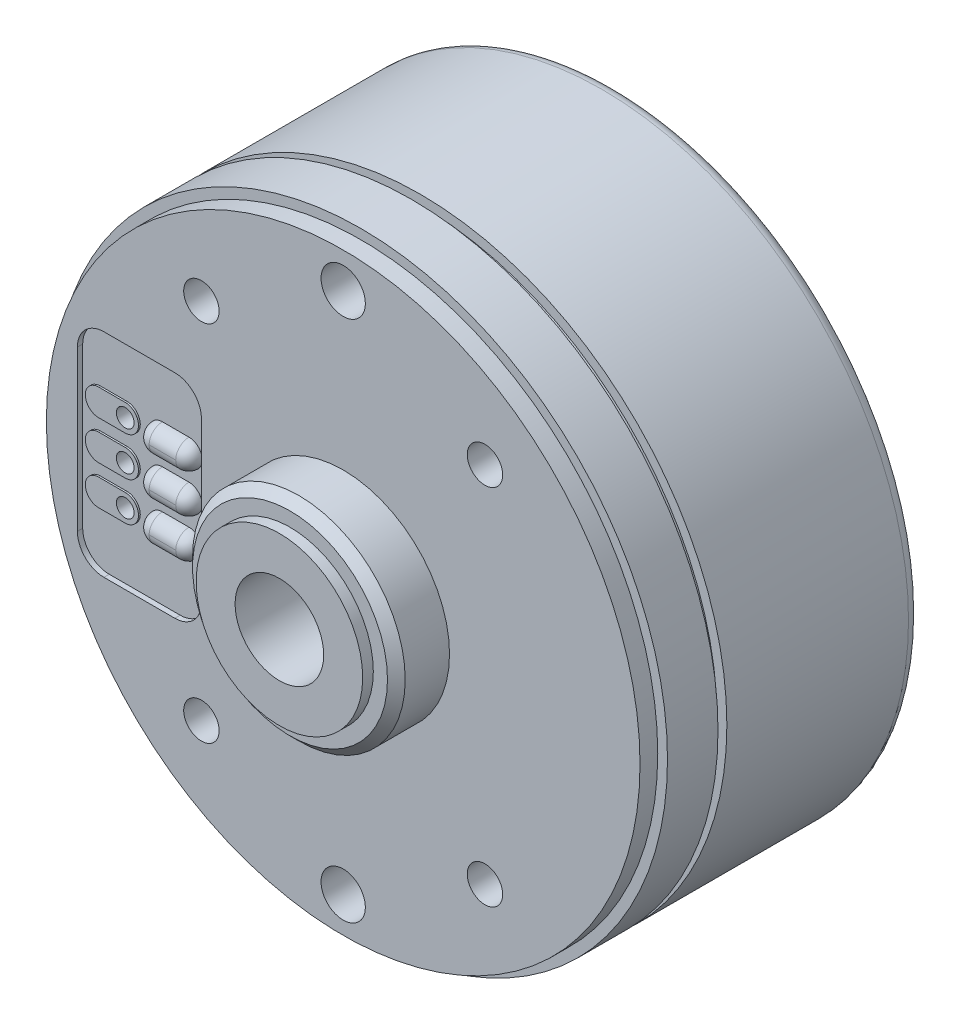
from build123d import *

# Parameters (mm, degrees)
SKETCH_1_R           = 6
EXTRUDE_1_DEPTH      = 3
SKETCH_1_3_R         = 4.7
EXTRUDE_2_DEPTH      = 3.6
SKETCH_1_4_R         = 2.5
CUT_EXTRUDE_1_DEPTH  = 3.6
SKETCH_1_7_R         = 17.3
EXTRUDE_4_DEPTH      = 15.3
SKETCH_1_8_R         = 17.3
SKETCH_1_8_R_2       = 16.75
CUT_EXTRUDE_3_DEPTH  = 4.35
SKETCH_1_5_R         = 17.3
EXTRUDE_3_DEPTH      = 3.85
SKETCH_1_6_R         = 17.3
SKETCH_1_6_R_2       = 16.75
CUT_EXTRUDE_2_DEPTH  = 1
SKETCH_5_R           = 3.25
CUT_EXTRUDE_4_DEPTH  = 10.6
SKETCH_5_3_R         = 1.25
SKETCH_5_3_R_2       = 1
CUT_EXTRUDE_5_DEPTH  = 2.5
SKETCH_1_9_R         = 1.25
SKETCH_1_9_R_2       = 1
CUT_EXTRUDE_6_DEPTH  = 3.8
FILLET_1_R           = 0.7
CHAMFER_1_SIZE       = 0.5
CUT_EXTRUDE_START    = -10
SKETCH_1_10_R        = 2.5
CUT_EXTRUDE_7_DEPTH  = 10
CUT_EXTRUDE_8_DEPTH  = 0.3
EXTRUDE_5_DEPTH      = 0.45
EXTRUDE_5_2_DEPTH    = 0.45
EXTRUDE_5_3_DEPTH    = 0.45
EXTRUDE_6_DEPTH      = 0.3
FILLET_2_R           = 0.75
FILLET_3_R           = 0.75
FILLET_4_R           = 0.75
EXTRUDE_7_DEPTH      = 0.3
SKETCH_1_13_R        = 0.5
CUT_EXTRUDE_9_DEPTH  = 2
CUT_EXTRUDE_10_DEPTH = 0.2


with BuildPart() as part:
    # 草图1 → 凸台-拉伸1 (new body)
    with BuildSketch(Plane.XY):
        Circle(SKETCH_1_R)
    extrude(amount=EXTRUDE_1_DEPTH)

    # 草图1<3> → 凸台-拉伸2 (add)
    with BuildSketch(Plane.XY):
        Circle(SKETCH_1_3_R)
    extrude(amount=EXTRUDE_2_DEPTH)

    # 草图1<4> → 切除-拉伸1 (cut)
    with BuildSketch(Plane.XY):
        Circle(SKETCH_1_4_R)
    extrude(amount=CUT_EXTRUDE_1_DEPTH, mode=Mode.SUBTRACT)

    # 草图1<7> → 凸台-拉伸4 (add)
    with BuildSketch(Plane.XY):
        Circle(SKETCH_1_7_R)
    extrude(amount=-EXTRUDE_4_DEPTH)

    # 草图1<8> → 切除-拉伸3 (cut)
    with BuildSketch(Plane.XY):
        Circle(SKETCH_1_8_R)
        Circle(SKETCH_1_8_R_2, mode=Mode.SUBTRACT)
    extrude(amount=-CUT_EXTRUDE_3_DEPTH, mode=Mode.SUBTRACT)

    # 草图1<5> → 凸台-拉伸3 (add)
    with BuildSketch(Plane.XY):
        Circle(SKETCH_1_5_R)
    extrude(amount=-EXTRUDE_3_DEPTH)

    # 草图1<6> → 切除-拉伸2 (cut)
    with BuildSketch(Plane.XY):
        Circle(SKETCH_1_6_R)
        Circle(SKETCH_1_6_R_2, mode=Mode.SUBTRACT)
    extrude(amount=-CUT_EXTRUDE_2_DEPTH, mode=Mode.SUBTRACT)

    # 草图5 → 切除-拉伸4 (cut)
    with BuildSketch(Plane(origin=(0, 0, -15.3), x_dir=(-1, 0, 0), z_dir=(0, 0, -1))):
        Circle(SKETCH_5_R)
    extrude(amount=-CUT_EXTRUDE_4_DEPTH, mode=Mode.SUBTRACT)

    # 草图5<3> → 切除-拉伸5 (cut)
    with BuildSketch(Plane(origin=(0, 0, -15.3), x_dir=(-1, 0, 0), z_dir=(0, 0, -1))):
        with Locations((-5.25, 5.25)):
            Circle(SKETCH_5_3_R)
        with Locations((0, 6.25)):
            Circle(SKETCH_5_3_R_2)
        with Locations((5.25, 5.25)):
            Circle(SKETCH_5_3_R)
        with Locations((6.25, 0)):
            Circle(SKETCH_5_3_R_2)
        with Locations((5.25, -5.25)):
            Circle(SKETCH_5_3_R)
        with Locations((0, -6.25)):
            Circle(SKETCH_5_3_R_2)
        with Locations((-5.25, -5.25)):
            Circle(SKETCH_5_3_R)
        with Locations((-6.25, 0)):
            Circle(SKETCH_5_3_R_2)
    extrude(amount=-CUT_EXTRUDE_5_DEPTH, mode=Mode.SUBTRACT)

    # 草图1<9> → 切除-拉伸6 (cut)
    with BuildSketch(Plane.XY):
        with Locations((0, 14.75)):
            Circle(SKETCH_1_9_R)
        with Locations((8, 10.25)):
            Circle(SKETCH_1_9_R_2)
        with Locations((8, -10.25)):
            Circle(SKETCH_1_9_R_2)
        with Locations((0, -14.75)):
            Circle(SKETCH_1_9_R)
        with Locations((-8, -10.25)):
            Circle(SKETCH_1_9_R_2)
        with Locations((-8, 10.25)):
            Circle(SKETCH_1_9_R_2)
    extrude(amount=-CUT_EXTRUDE_6_DEPTH, mode=Mode.SUBTRACT)

    # 圆角1
    fillet_1_edges = [part.edges().sort_by_distance(p)[0] for p in [
        (-17.3, 0, -15.3),
    ]]
    fillet(fillet_1_edges, radius=FILLET_1_R)

    # 倒角1
    chamfer_1_edges = [part.edges().sort_by_distance(p)[0] for p in [
        (-6, 0, 3),
    ]]
    chamfer(chamfer_1_edges, length=CHAMFER_1_SIZE)

    # 草图1<10> → 切除-拉伸7 (cut)
    with BuildSketch(Plane.XY.offset(CUT_EXTRUDE_START)):
        with Locations(Location((0, 0, 0), (0, 0, 180))):
            Circle(SKETCH_1_10_R)
    extrude(amount=CUT_EXTRUDE_7_DEPTH, mode=Mode.SUBTRACT)

    # 草图1<11> → 切除-拉伸8 (cut)
    with BuildSketch(Plane.XY):
        with BuildLine():
            Line((-9.5, 6), (-13.5, 6))
            ThreePointArc((-13.5, 6), (-14.560660172, 5.560660172), (-15, 4.5))
            Line((-15, 4.5), (-15, -4.5))
            ThreePointArc((-15, -4.5), (-14.560660172, -5.560660172), (-13.5, -6))
            Line((-13.5, -6), (-9.5, -6))
            ThreePointArc((-9.5, -6), (-8.439339828, -5.560660172), (-8, -4.5))
            Line((-8, -4.5), (-8, 4.5))
            ThreePointArc((-8, 4.5), (-8.439339828, 5.560660172), (-9.5, 6))
        make_face()
    extrude(amount=-CUT_EXTRUDE_8_DEPTH, mode=Mode.SUBTRACT)



with BuildPart() as body_2:
    # 草图1<12> → 凸台-拉伸5 (new body)
    with BuildSketch(Plane.XY):
        with BuildLine():
            ThreePointArc((-9, 0.75), (-8.25, 0), (-9, -0.75))
            Line((-9, -0.75), (-10.5, -0.75))
            ThreePointArc((-10.5, -0.75), (-11.25, 0), (-10.5, 0.75))
            Line((-10.5, 0.75), (-9, 0.75))
        make_face()
    extrude(amount=EXTRUDE_5_DEPTH)


with BuildPart() as body_3:
    # 草图1<12> → Extrude 5 2 (new body)
    with BuildSketch(Plane.XY):
        with BuildLine():
            ThreePointArc((-9, -1.45), (-8.25, -2.2), (-9, -2.95))
            Line((-9, -2.95), (-10.5, -2.95))
            ThreePointArc((-10.5, -2.95), (-11.25, -2.2), (-10.5, -1.45))
            Line((-10.5, -1.45), (-9, -1.45))
        make_face()
    extrude(amount=EXTRUDE_5_2_DEPTH)


with BuildPart() as body_4:
    # 草图1<12> → Extrude 5 3 (new body)
    with BuildSketch(Plane.XY):
        with BuildLine():
            ThreePointArc((-9, 2.95), (-8.25, 2.2), (-9, 1.45))
            Line((-9, 1.45), (-10.5, 1.45))
            ThreePointArc((-10.5, 1.45), (-11.25, 2.2), (-10.5, 2.95))
            Line((-10.5, 2.95), (-9, 2.95))
        make_face()
    extrude(amount=EXTRUDE_5_3_DEPTH)


with BuildPart() as part_1:
    add(part.part)

    add(body_2.part)  # 凸台-拉伸6 merges body 2

    add(body_3.part)  # 凸台-拉伸6 merges body 3

    add(body_4.part)  # 凸台-拉伸6 merges body 4
    # 草图1<14> → 凸台-拉伸6 (add)
    with BuildSketch(Plane.XY):
        with BuildLine():
            Line((-10.5, -0.75), (-9, -0.75))
            ThreePointArc((-9, -0.75), (-8.25, 0), (-9, 0.75))
            Line((-9, 0.75), (-10.5, 0.75))
            ThreePointArc((-10.5, 0.75), (-11.25, 0), (-10.5, -0.75))
        make_face()
        with BuildLine():
            Line((-10.5, -2.95), (-9, -2.95))
            ThreePointArc((-9, -2.95), (-8.25, -2.2), (-9, -1.45))
            Line((-9, -1.45), (-10.5, -1.45))
            ThreePointArc((-10.5, -1.45), (-11.25, -2.2), (-10.5, -2.95))
        make_face()
        with BuildLine():
            Line((-10.5, 1.45), (-9, 1.45))
            ThreePointArc((-9, 1.45), (-8.25, 2.2), (-9, 2.95))
            Line((-9, 2.95), (-10.5, 2.95))
            ThreePointArc((-10.5, 2.95), (-11.25, 2.2), (-10.5, 1.45))
        make_face()
    extrude(amount=-EXTRUDE_6_DEPTH)

    # 圆角2
    fillet_2_edges = [part_1.edges().sort_by_distance(p)[0] for p in [
        (-11.25, 2.2, 0.45),
        (-9.75, 1.45, 0.45),
        (-8.25, 2.2, 0.45),
        (-9.75, 2.95, 0.45),
    ]]
    fillet(fillet_2_edges, radius=FILLET_2_R - 0.0001)  # a hair under: the kernel refuses the full size

    # 圆角3
    fillet_3_edges = [part_1.edges().sort_by_distance(p)[0] for p in [
        (-11.25, 0, 0.45),
        (-9.75, -0.75, 0.45),
        (-8.25, 0, 0.45),
        (-9.75, 0.75, 0.45),
    ]]
    fillet(fillet_3_edges, radius=FILLET_3_R - 0.0001)  # a hair under: the kernel refuses the full size

    # 圆角4
    fillet_4_edges = [part_1.edges().sort_by_distance(p)[0] for p in [
        (-11.25, -2.2, 0.45),
        (-9.75, -2.95, 0.45),
        (-8.25, -2.2, 0.45),
        (-9.75, -1.45, 0.45),
    ]]
    fillet(fillet_4_edges, radius=FILLET_4_R - 0.0001)  # a hair under: the kernel refuses the full size

    # 草图1<15> → 凸台-拉伸7 (add)
    with BuildSketch(Plane.XY):
        with BuildLine():
            Line((-12.5, -0.75), (-14, -0.75))
            ThreePointArc((-14, -0.75), (-14.75, 0), (-14, 0.75))
            Line((-14, 0.75), (-12.5, 0.75))
            ThreePointArc((-12.5, 0.75), (-11.75, 0), (-12.5, -0.75))
        make_face()
        with BuildLine():
            Line((-12.5, 1.45), (-14, 1.45))
            ThreePointArc((-14, 1.45), (-14.75, 2.2), (-14, 2.95))
            Line((-14, 2.95), (-12.5, 2.95))
            ThreePointArc((-12.5, 2.95), (-11.75, 2.2), (-12.5, 1.45))
        make_face()
        with BuildLine():
            Line((-12.5, -2.95), (-14, -2.95))
            ThreePointArc((-14, -2.95), (-14.75, -2.2), (-14, -1.45))
            Line((-14, -1.45), (-12.5, -1.45))
            ThreePointArc((-12.5, -1.45), (-11.75, -2.2), (-12.5, -2.95))
        make_face()
    extrude(amount=-EXTRUDE_7_DEPTH)

    # 草图1<13> → 切除-拉伸9 (cut)
    with BuildSketch(Plane.XY):
        with Locations((-12.5, 0)):
            Circle(SKETCH_1_13_R)
        with Locations((-12.5, 2.2)):
            Circle(SKETCH_1_13_R)
        with Locations((-12.5, -2.2)):
            Circle(SKETCH_1_13_R)
    extrude(amount=-CUT_EXTRUDE_9_DEPTH, mode=Mode.SUBTRACT)

    # 草图1<16> → 切除-拉伸10 (cut)
    with BuildSketch(Plane.XY):
        with BuildLine():
            Line((-12.5, -0.75), (-14, -0.75))
            ThreePointArc((-14, -0.75), (-14.75, 0), (-14, 0.75))
            Line((-14, 0.75), (-12.5, 0.75))
            ThreePointArc((-12.5, 0.75), (-11.75, 0), (-12.5, -0.75))
        make_face()
        with BuildLine():
            Line((-12.5, 1.45), (-14, 1.45))
            ThreePointArc((-14, 1.45), (-14.75, 2.2), (-14, 2.95))
            Line((-14, 2.95), (-12.5, 2.95))
            ThreePointArc((-12.5, 2.95), (-11.75, 2.2), (-12.5, 1.45))
        make_face()
        with BuildLine():
            Line((-12.5, -2.95), (-14, -2.95))
            ThreePointArc((-14, -2.95), (-14.75, -2.2), (-14, -1.45))
            Line((-14, -1.45), (-12.5, -1.45))
            ThreePointArc((-12.5, -1.45), (-11.75, -2.2), (-12.5, -2.95))
        make_face()
    extrude(amount=-CUT_EXTRUDE_10_DEPTH, mode=Mode.SUBTRACT)


solid = part_1.part
